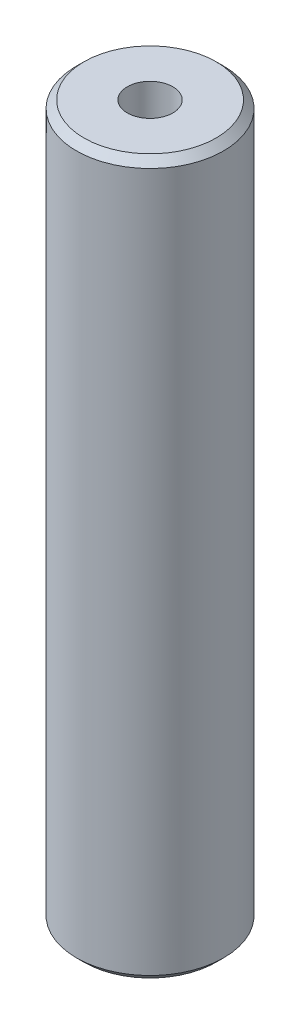
from build123d import *

# Parameters (mm, degrees)
SKETCH1_R           = 42.5
BOSS_EXTRUDE1_DEPTH = 412.433679047
SKETCH2_R           = 13.141238518
CUT_EXTRUDE1_DEPTH  = 417.790162567
CHAMFER1_SIZE       = 4.312369025


with BuildPart() as part:
    # Sketch1 → Boss-Extrude1 (new body)
    with BuildSketch(Plane(origin=(0, 0, 0), x_dir=(1, 0, 0), z_dir=(0, 1, 0))):
        Circle(SKETCH1_R)
    extrude(amount=BOSS_EXTRUDE1_DEPTH)

    # Sketch2 → Cut-Extrude1 (cut, through all)
    with BuildSketch(Plane(origin=(0, 0, 0), x_dir=(1, 0, 0), z_dir=(0, 1, 0))):
        Circle(SKETCH2_R)
    extrude(amount=CUT_EXTRUDE1_DEPTH, mode=Mode.SUBTRACT)

    # Chamfer1
    chamfer1_edges = [part.edges().sort_by_distance(p)[0] for p in [
        (-42.5, 412.433679047, 0),
        (-42.5, 0, 0),
    ]]
    chamfer(chamfer1_edges, length=CHAMFER1_SIZE)


solid = part.part
